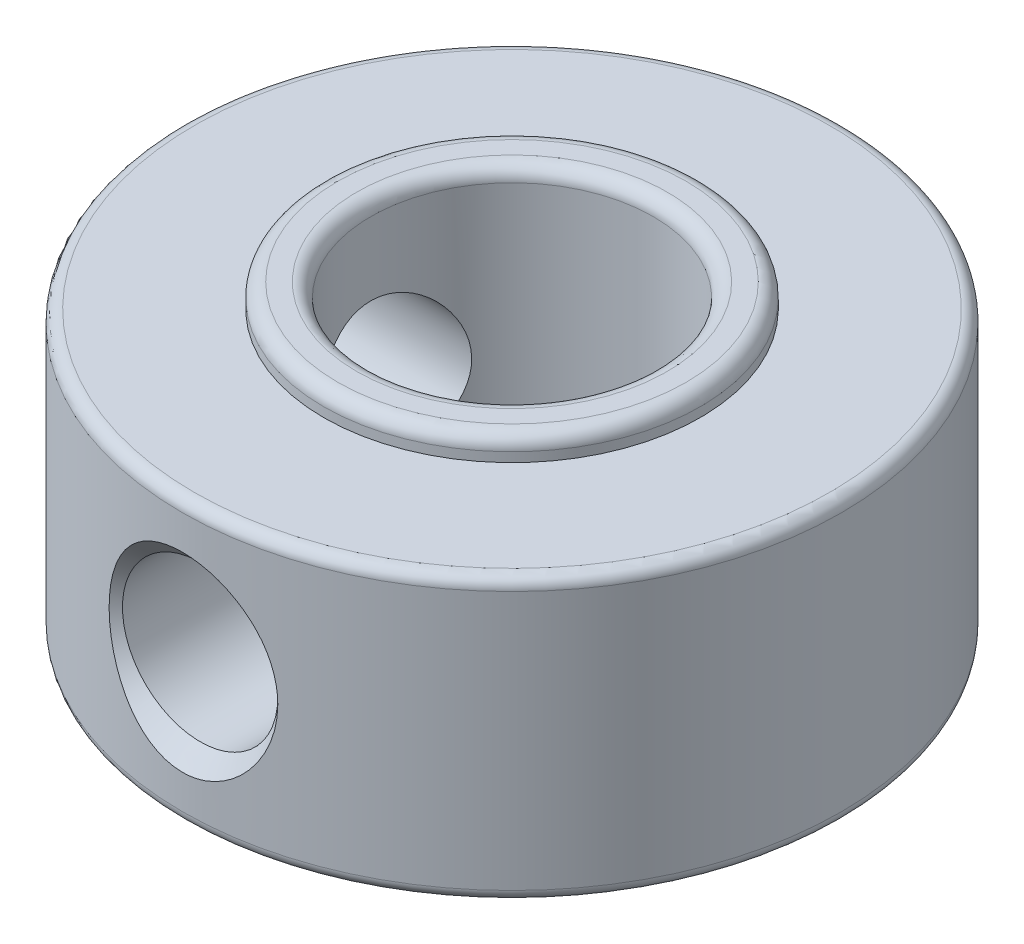
from build123d import *

# Parameters (mm, degrees)
SKETCH1_R           = 7
SKETCH1_R_2         = 3
BOSS_EXTRUDE1_DEPTH = 6
SKETCH2_R           = 4
SKETCH2_R_2         = 3
BOSS_EXTRUDE2_DEPTH = 0.5
FILLET1_R           = 0.3
FILLET2_R           = 0.25
CIRPATTERN1_COUNT   = 2
CIRPATTERN1_ANGLE   = 90


# Read off the part's stored shape, not the designer's step: M4 Tapped Hole1
with BuildPart() as part:
    # Sketch1 → Boss-Extrude1 (new body)
    with BuildSketch(Plane(origin=(0, 0, 0), x_dir=(1, 0, 0), z_dir=(0, 1, 0))):
        with Locations(Location((0, 0, 0), (0, 0, 270))):
            Circle(SKETCH1_R)
        with Locations(Location((0, 0, 0), (0, 0, 270))):
            Circle(SKETCH1_R_2, mode=Mode.SUBTRACT)
    extrude(amount=BOSS_EXTRUDE1_DEPTH)

    # Sketch2 → Boss-Extrude2 (add)
    with BuildSketch(Plane(origin=(0, 6, 0), x_dir=(1, 0, 0), z_dir=(0, 1, 0))):
        with Locations(Location((0, 0, 0), (0, 0, 270))):
            Circle(SKETCH2_R)
        with Locations(Location((0, 0, 0), (0, 0, 270))):
            Circle(SKETCH2_R_2, mode=Mode.SUBTRACT)
    extrude(amount=BOSS_EXTRUDE2_DEPTH)

    # Fillet1
    fillet1_edges = [part.edges().sort_by_distance(p)[0] for p in [
        (0, 6.5, -4),
        (0, 6.5, -3),
    ]]
    fillet(fillet1_edges, radius=FILLET1_R)

    # Fillet2
    fillet2_edges = [part.edges().sort_by_distance(p)[0] for p in [
        (0, 0, -7),
        (0, 6, -7),
    ]]
    fillet(fillet2_edges, radius=FILLET2_R)

    # M4 Tapped Hole1 outline → M4 Tapped Hole1 (revolve, cut)
    with BuildSketch(Plane.XZ.offset(-3)):
        Polygon((2.025001015, 7.000001015), (0, 7.000001015), (0, 2.505277626), (1.65, 2.505277626), (1.65, 6.625), align=None)
    m4_tapped_hole1 = revolve(axis=Axis((0, 3, 0), (0, 0, 1)), mode=Mode.SUBTRACT)

    # CirPattern1: M4 Tapped Hole1 ×2 about axis
    cirpattern1_axis = Axis((0, 6, 0), (0, -1, 0))
    for i in range(1, CIRPATTERN1_COUNT):
        add(m4_tapped_hole1.rotate(cirpattern1_axis, i * CIRPATTERN1_ANGLE / (CIRPATTERN1_COUNT - 1)), mode=Mode.SUBTRACT)


solid = part.part
